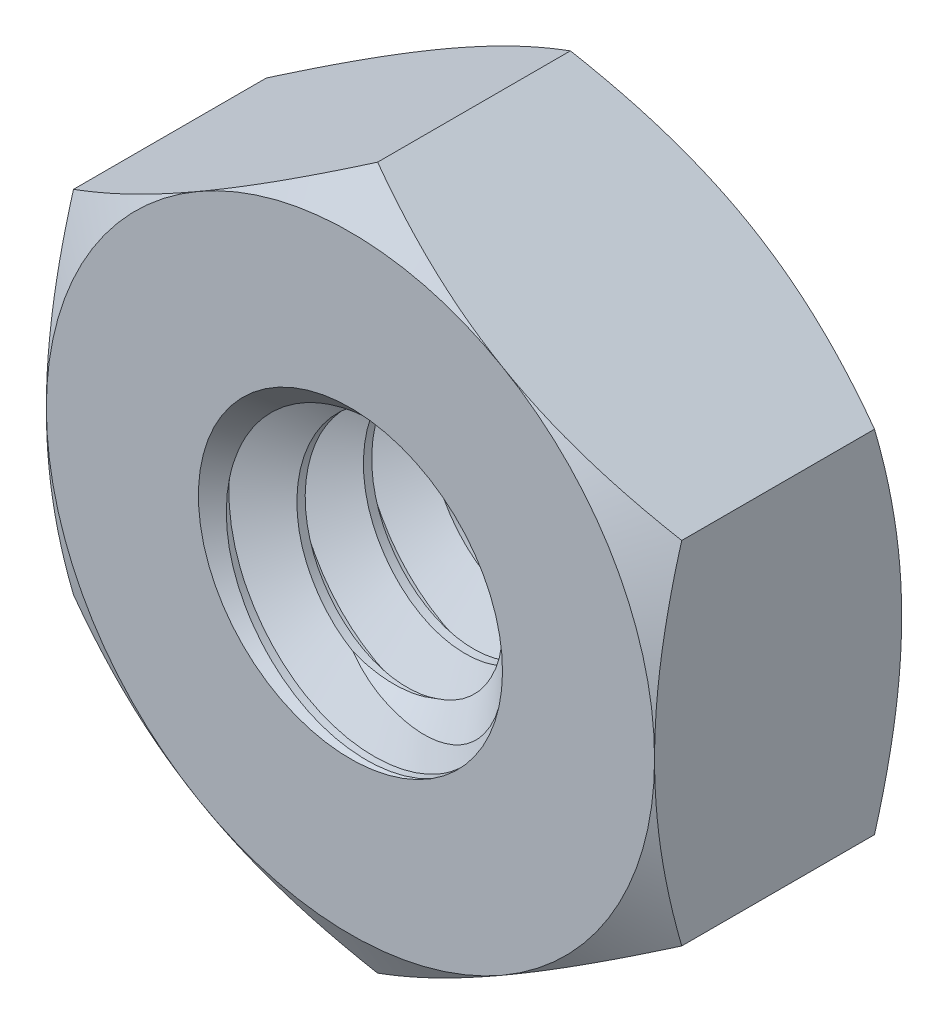
from build123d import *

# Parameters (mm, degrees)
EXTRUDE1_DEPTH          = 0.65
SKETCH13_R              = 0.8
BOSS_EXTRUDE1_DEPTH     = 1.3
CUT_SWEEP1_PITCH        = 0.35
SKETCH7_OUTSIDE_W       = 94.2
SKETCH7_OUTSIDE_H       = 94.696
SKETCH7_OUTSIDE_R       = 1.6
EXTRUDE2_DEPTH          = 25.4
EXTRUDE2_DRAFT          = -60
MIRROR2_COPY_1_SKETCH_W = 94.2
MIRROR2_COPY_1_SKETCH_H = 94.696
MIRROR2_COPY_1_SKETCH_R = 1.6
MIRROR2_COPY_1_DEPTH    = 25.4
MIRROR2_COPY_1_DRAFT    = -60


with BuildPart() as part:
    # Sketch1 → Extrude1 (new, symmetric)
    with BuildSketch(Plane.XY):
        Polygon((-1.6, 0.923760431), (-1.6, -0.923760431), (0, -1.847520861), (1.6, -0.923760431), (1.6, 0.923760431), (0, 1.847520861), align=None)
    extrude(amount=EXTRUDE1_DEPTH, both=True)

    # Cut-Extrude2 cone 1 section (through the dimple's axis) → Cut-Extrude2 (revolve, cut)
    with BuildSketch(Plane(origin=(0, 0, 0.65), x_dir=(0, -1, 0), z_dir=(1, 0, 0))):
        Polygon((0, 0), (0.8, 0), (0, 0.8), align=None)
    revolve(axis=Axis((0, 0, 0.65), (0, 0, -1)), mode=Mode.SUBTRACT)

    # Cut-Extrude3 cone 1 section (through the dimple's axis) → Cut-Extrude3 (revolve, cut)
    with BuildSketch(Plane(origin=(0, 0, -0.65), x_dir=(0, 1, 0), z_dir=(1, 0, 0))):
        Polygon((0, 0), (0.8, 0), (0, 0.8), align=None)
    revolve(axis=Axis((0, 0, -0.65), (0, 0, 1)), mode=Mode.SUBTRACT)


with BuildPart() as body_2:
    # Sketch13 → Boss-Extrude1 (new body)
    with BuildSketch(Plane(origin=(0, 0, -0.65), x_dir=(-1, 0, 0), z_dir=(0, 0, -1))):
        Circle(SKETCH13_R)
    extrude(amount=-BOSS_EXTRUDE1_DEPTH)

    # Cut-Sweep1: arcs per turn and ends read off the stored shape
    # Cut-Sweep1: the profile of Sketch12 profile screwed along a right-hand helix through 5.666667 turns, 6 arcs to a turn; built about Z, then put on its axis
    cut_sweep1_z = Axis((0, 0, 0), (0, 0, 1))
    cut_sweep1_corners = [(0.8003, 0, -0.656423205), (0.8003, 0, -0.349826795), (0.572668332, 0, -0.48125), (0.572668332, 0, -0.525)]
    with BuildLine(mode=Mode.PRIVATE) as cut_sweep1_profile:
        Line(cut_sweep1_corners[0], cut_sweep1_corners[1])
        Line(cut_sweep1_corners[1], cut_sweep1_corners[2])
        Line(cut_sweep1_corners[2], cut_sweep1_corners[3])
        Line(cut_sweep1_corners[3], cut_sweep1_corners[0])
    cut_sweep1_cap = Face(cut_sweep1_profile.wire())
    cut_sweep1_turn_angles = [0, 30, 60, 90, 120, 150, 180, 210, 240, 270, 300, 330, 360]
    cut_sweep1_turn_weights = [1, 0.8660254037844387, 1, 0.8660254037844387, 1, 0.8660254037844387, 1, 0.8660254037844387, 1, 0.8660254037844387, 1, 0.8660254037844387, 1]
    cut_sweep1_turn_rails = [Edge.make_bspline([Vector(p[0], p[1], 0).rotate(cut_sweep1_z, cut_sweep1_turn_angles[k]) / cut_sweep1_turn_weights[k] + Vector(0, 0, p[2] + CUT_SWEEP1_PITCH * cut_sweep1_turn_angles[k] / 360) for k in range(13)], [0, 0, 0, 1, 1, 2, 2, 3, 3, 4, 4, 5, 5, 6, 6, 6], 2, cut_sweep1_turn_weights) for p in cut_sweep1_corners]
    cut_sweep1_turn_sides = [Face.make_surface_from_curves(cut_sweep1_turn_rails[p[0]], cut_sweep1_turn_rails[p[1]]) for p in [(0, 1), (1, 2), (2, 3), (3, 0)]]
    cut_sweep1_last_angles = [1800, 1830, 1860, 1890, 1920, 1950, 1980, 2010, 2040]
    cut_sweep1_last_weights = [1, 0.8660254037844387, 1, 0.8660254037844387, 1, 0.8660254037844387, 1, 0.8660254037844387, 1]
    cut_sweep1_last_rails = [Edge.make_bspline([Vector(p[0], p[1], 0).rotate(cut_sweep1_z, cut_sweep1_last_angles[k]) / cut_sweep1_last_weights[k] + Vector(0, 0, p[2] + CUT_SWEEP1_PITCH * cut_sweep1_last_angles[k] / 360) for k in range(9)], [0, 0, 0, 1, 1, 2, 2, 3, 3, 4, 4, 4], 2, cut_sweep1_last_weights) for p in cut_sweep1_corners]
    cut_sweep1_last_sides = [Face.make_surface_from_curves(cut_sweep1_last_rails[p[0]], cut_sweep1_last_rails[p[1]]) for p in [(0, 1), (1, 2), (2, 3), (3, 0)]]
    cut_sweep1 = Plane(origin=(0, 0, -0.65), x_dir=(0, 1, 0), z_dir=(0, 0, 1)) * Solid(Shell([*[p.moved(Location((0, 0, CUT_SWEEP1_PITCH * i))) for i in range(5) for p in cut_sweep1_turn_sides], *cut_sweep1_last_sides, cut_sweep1_cap, cut_sweep1_cap.rotate(cut_sweep1_z, 2040).moved(Location((0, 0, CUT_SWEEP1_PITCH * 2040 / 360)))]))
    add(cut_sweep1, mode=Mode.SUBTRACT)


with BuildPart() as part_1:
    add(part.part)

    # Combine1: cut body 2
    add(body_2.part, mode=Mode.SUBTRACT)


with BuildPart() as extrude2_tool:
    # Sketch7 outside → Extrude2 (with draft: the straight prism first)
    with BuildSketch(Plane.XY.offset(0.65)):
        Rectangle(SKETCH7_OUTSIDE_W, SKETCH7_OUTSIDE_H)
        Circle(SKETCH7_OUTSIDE_R, mode=Mode.SUBTRACT)
    extrude(amount=-EXTRUDE2_DEPTH)
    # Extrude2: the draft: its side faces are tilted about the plane it starts from
    extrude2_sides = [extrude2_tool.faces().sort_by_distance(p)[0] for p in [
        (0, -47.348, -12.05),
        (47.1, 0, -12.05),
        (0, 47.348, -12.05),
        (-47.1, 0, -12.05),
        (-1.6, 0, -12.05),
    ]]
    draft(extrude2_sides, Plane.XY.offset(0.65), EXTRUDE2_DRAFT)


with BuildPart() as part_2:
    add(part_1.part)

    # Extrude2: cut by extrude2_tool
    add(extrude2_tool.part, mode=Mode.SUBTRACT)


with BuildPart() as mirror2_copy_1_tool:
    # Mirror2 copy 1 sketch → Mirror2 copy 1 (with draft: the straight prism first)
    with BuildSketch(Plane(origin=(0, 0, -0.65), x_dir=(1, 0, 0), z_dir=(0, 0, -1))):
        Rectangle(MIRROR2_COPY_1_SKETCH_W, MIRROR2_COPY_1_SKETCH_H)
        Circle(MIRROR2_COPY_1_SKETCH_R, mode=Mode.SUBTRACT)
    extrude(amount=-MIRROR2_COPY_1_DEPTH)
    # Mirror2 copy 1: the draft: its side faces are tilted about the plane it starts from
    mirror2_copy_1_sides = [mirror2_copy_1_tool.faces().sort_by_distance(p)[0] for p in [
        (0, -47.348, 12.05),
        (47.1, 0, 12.05),
        (0, 47.348, 12.05),
        (-47.1, 0, 12.05),
        (-1.6, 0, 12.05),
    ]]
    draft(mirror2_copy_1_sides, Plane(origin=(0, 0, -0.65), x_dir=(1, 0, 0), z_dir=(0, 0, -1)), MIRROR2_COPY_1_DRAFT)


with BuildPart() as part_3:
    add(part_2.part)

    # Mirror2 copy 1: cut by mirror2_copy_1_tool
    add(mirror2_copy_1_tool.part, mode=Mode.SUBTRACT)


solid = part_3.part
